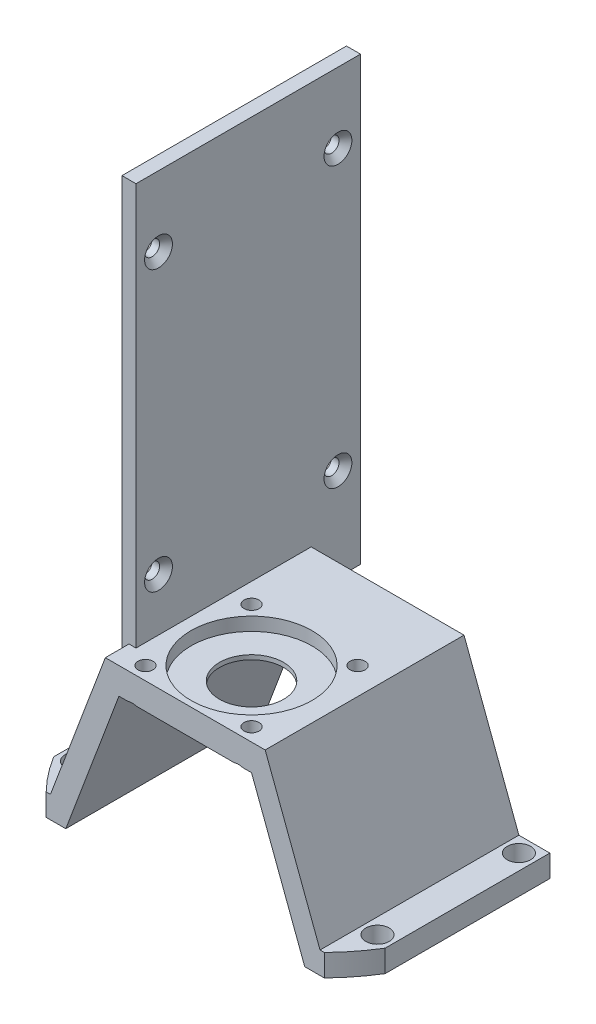
from build123d import *

# Parameters (mm, degrees)
BOSS_EXTRUDE1_DEPTH                             = 45
SKETCH3_R                                       = 13.7
CUT_EXTRUDE1_DEPTH                              = 3
CSK_FOR_M3_FLAT_HEAD_MACHINE_SCREW4_AT_2_COUNT  = 2
CSK_FOR_M3_FLAT_HEAD_MACHINE_SCREW4_AT_2_PITCH  = 24
CSK_FOR_M3_FLAT_HEAD_MACHINE_SCREW4_AT_3_COUNT  = 2
CSK_FOR_M3_FLAT_HEAD_MACHINE_SCREW4_AT_3_PITCH  = 33.941125497
CSK_FOR_M3_FLAT_HEAD_MACHINE_SCREW4_AT_4_COUNT  = 2
CSK_FOR_M3_FLAT_HEAD_MACHINE_SCREW4_AT_4_PITCH  = 24
SKETCH10_R                                      = 7.25
CUT_EXTRUDE2_DEPTH                              = 69.23672032
SKETCH15_R                                      = 48.495489481
SKETCH15_R_2                                    = 44
CUT_EXTRUDE4_DEPTH                              = 70.822990483
SKETCH11_R                                      = 10.5
CUT_EXTRUDE3_DEPTH                              = 2
CBORE_FOR_M5_HEX_HEAD_BOLT1_D                   = 3.4
CBORE_FOR_M5_HEX_HEAD_BOLT1_CBORE_D             = 5.3
CBORE_FOR_M5_HEX_HEAD_BOLT1_CBORE_DEPTH         = 4
BOSS_EXTRUDE6_DEPTH                             = 1.5875
BOSS_EXTRUDE6_DEPTH_BACK                        = 1.5875
SKETCH28_W                                      = 50.8
SKETCH28_H                                      = 100
FILLET4_R                                       = 9
CSK_FOR_M3_FLAT_HEAD_MACHINE_SCREW3_D           = 3.4
CSK_FOR_M3_FLAT_HEAD_MACHINE_SCREW3_CSINK_D     = 6.3
CSK_FOR_M3_FLAT_HEAD_MACHINE_SCREW3_CSINK_ANGLE = 90
SKETCH32_W                                      = 50.8
SKETCH32_H                                      = 4.780360426
CUT_EXTRUDE5_DEPTH                              = 3.175


with BuildPart() as part:
    # Sketch1 → Boss-Extrude1 (new body)
    with BuildSketch(Plane.XY):
        Polygon((-37.5, 0), (-27.038942926, 0), (-15, 32), (15, 32), (27.038942926, 0), (37.5, 0), (37.5, 5), (30.5, 5), (18.084840108, 38), (-18.084840108, 38), (-30.5, 5), (-37.5, 5), align=None)
    extrude(amount=BOSS_EXTRUDE1_DEPTH)

    # Sketch3 → Cut-Extrude1 (cut)
    with BuildSketch(Plane(origin=(0, 38, 0), x_dir=(1, 0, 0), z_dir=(0, 1, 0))):
        with Locations(Location((0, -30, 0), (0, 0, 180))):
            Circle(SKETCH3_R)
    extrude(amount=-CUT_EXTRUDE1_DEPTH, mode=Mode.SUBTRACT)

    # Sketch6 → CSK for M3 Flat Head Machine Screw4 (revolve, cut)
    with BuildSketch(Plane(origin=(-12, 32, 42), x_dir=(0, 0, -1), z_dir=(1, 0, 0))):
        Polygon((0, 0), (0, 6), (1.7, 6), (1.7, 1.45), (3.15, 0), align=None)
    csk_for_m3_flat_head_machine_screw4 = revolve(axis=Axis((-12, 25.65, 42), (0, 1, 0)), mode=Mode.SUBTRACT)

    # CSK for M3 Flat Head Machine Screw4 at 2: CSK for M3 Flat Head Machine Screw4 ×2
    with Locations(*[(i * CSK_FOR_M3_FLAT_HEAD_MACHINE_SCREW4_AT_2_PITCH, 0, 0) for i in range(1, CSK_FOR_M3_FLAT_HEAD_MACHINE_SCREW4_AT_2_COUNT)]):
        add(csk_for_m3_flat_head_machine_screw4, mode=Mode.SUBTRACT)

    # CSK for M3 Flat Head Machine Screw4 at 3: CSK for M3 Flat Head Machine Screw4 ×2
    with Locations(*[Vector(0.7071067811865476, 0, -0.7071067811865475) * (i * CSK_FOR_M3_FLAT_HEAD_MACHINE_SCREW4_AT_3_PITCH) for i in range(1, CSK_FOR_M3_FLAT_HEAD_MACHINE_SCREW4_AT_3_COUNT)]):
        add(csk_for_m3_flat_head_machine_screw4, mode=Mode.SUBTRACT)

    # CSK for M3 Flat Head Machine Screw4 at 4: CSK for M3 Flat Head Machine Screw4 ×2
    with Locations(*[(0, 0, -i * CSK_FOR_M3_FLAT_HEAD_MACHINE_SCREW4_AT_4_PITCH) for i in range(1, CSK_FOR_M3_FLAT_HEAD_MACHINE_SCREW4_AT_4_COUNT)]):
        add(csk_for_m3_flat_head_machine_screw4, mode=Mode.SUBTRACT)

    # Sketch10 → Cut-Extrude2 (cut, through all)
    with BuildSketch(Plane(origin=(0, 35, 0), x_dir=(1, 0, 0), z_dir=(0, 1, 0))):
        with Locations(Location((0, -30, 0), (0, 0, 180))):
            Circle(SKETCH10_R)
    extrude(amount=-CUT_EXTRUDE2_DEPTH, mode=Mode.SUBTRACT)

    # Sketch15 → Cut-Extrude4 (cut, through all)
    with BuildSketch(Plane(origin=(0, 38, 0), x_dir=(1, 0, 0), z_dir=(0, 1, 0))):
        with Locations((0, -14.25)):
            Circle(SKETCH15_R)
        with Locations((0, -14.25)):
            Circle(SKETCH15_R_2, mode=Mode.SUBTRACT)
    extrude(amount=-CUT_EXTRUDE4_DEPTH, mode=Mode.SUBTRACT)

    # Sketch11 → Cut-Extrude3 (cut)
    with BuildSketch(Plane.XZ.offset(-32)):
        with Locations((0, 30)):
            Circle(SKETCH11_R)
    extrude(amount=-CUT_EXTRUDE3_DEPTH, mode=Mode.SUBTRACT)

    # CBORE for M5 Hex Head Bolt1 (through all)
    with Locations(Plane(origin=(0, 5, 0), x_dir=(-1, 0, 0), z_dir=(0, 1, 0))):
        with Locations((34, 35.5), (34, 3.5), (-34, 3.5), (-34, 35.5)):
            CounterBoreHole(CBORE_FOR_M5_HEX_HEAD_BOLT1_D / 2, CBORE_FOR_M5_HEX_HEAD_BOLT1_CBORE_D / 2, CBORE_FOR_M5_HEX_HEAD_BOLT1_CBORE_DEPTH)

    # Sketch28 → Boss-Extrude6 (add, two sides: drawn at the far end of the back side and taken through both)
    with BuildSketch(Plane(origin=(-18.084840108, 0, 0), x_dir=(0, 0, -1), z_dir=(1, 0, 0)).offset(-BOSS_EXTRUDE6_DEPTH_BACK)):
        with Locations((-14.25, 79)):
            Rectangle(SKETCH28_W, SKETCH28_H)
    extrude(amount=BOSS_EXTRUDE6_DEPTH + BOSS_EXTRUDE6_DEPTH_BACK)

    # Fillet4
    # the kernel refuses this fillet: 9 mm, written as the material it adds along each edge
    with BuildSketch(Plane(origin=(-16.497340108, 29, 0), x_dir=(0, -1, 0), z_dir=(-1, 0, 0))) as fillet4_piece_1_section:
        with BuildLine():
            CenterArc((FILLET4_R, -FILLET4_R), FILLET4_R, 90, 90)
            Line((0, -FILLET4_R), (0, 0))
            Line((0, 0), (FILLET4_R, 0))
        make_face()
    fillet4_piece_1 = extrude(amount=3.175, mode=Mode.PRIVATE)
    fillet4_piece_1 = split(fillet4_piece_1, bisect_by=Plane(origin=(-16.91095331, 26.920608371, -2.290762679), z_dir=(-0.9359541711547182, 0.35212183899622657, 0)), keep=Keep.TOP, mode=Mode.PRIVATE)
    add(fillet4_piece_1)

    # CSK for M3 Flat Head Machine Screw3 (through all)
    with Locations(Plane(origin=(-16.497340108, 0, 0), x_dir=(0, 0, -1), z_dir=(1, 0, 0))):
        with Locations((6.05, 49.9), (-34.55, 49.9), (-34.55, 113.1), (6.05, 113.1)):
            CounterSinkHole(CSK_FOR_M3_FLAT_HEAD_MACHINE_SCREW3_D / 2, CSK_FOR_M3_FLAT_HEAD_MACHINE_SCREW3_CSINK_D / 2, counter_sink_angle=CSK_FOR_M3_FLAT_HEAD_MACHINE_SCREW3_CSINK_ANGLE)

    # Sketch32 → Cut-Extrude5 (cut)
    with BuildSketch(Plane.ZY.offset(19.672340108)):
        with Locations((14.25, 31.390180213)):
            Rectangle(SKETCH32_W, SKETCH32_H)
    extrude(amount=CUT_EXTRUDE5_DEPTH, mode=Mode.SUBTRACT)


solid = part.part
